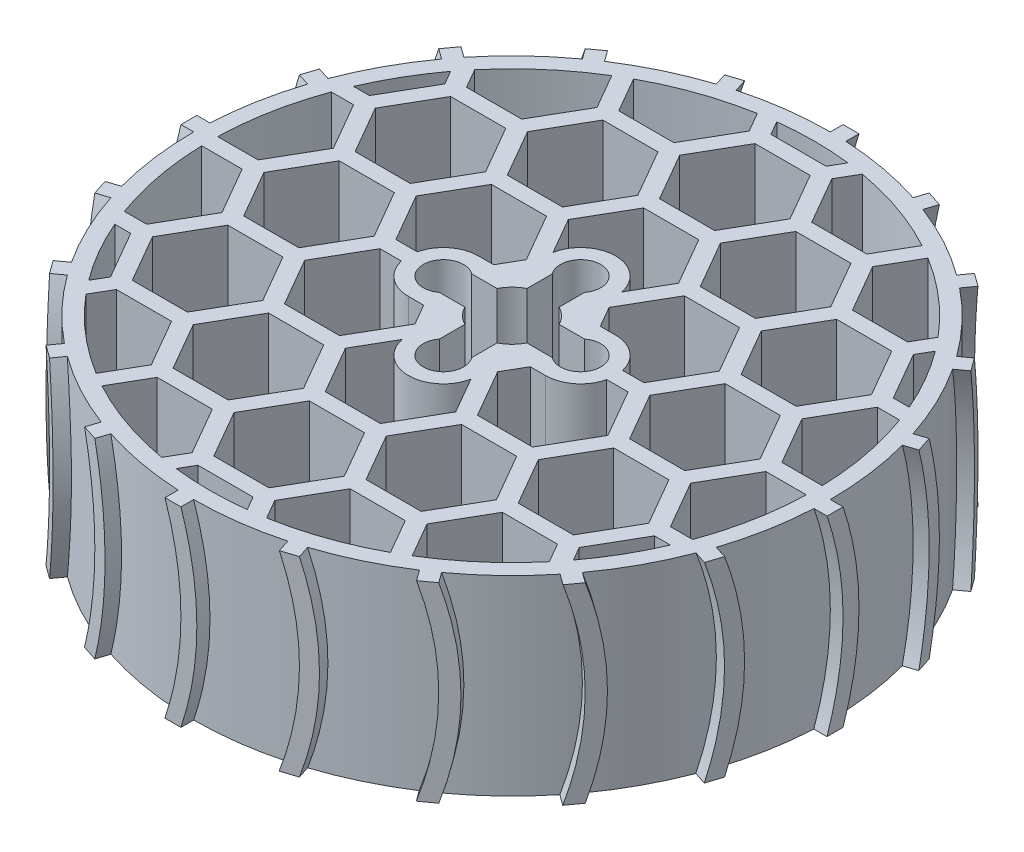
from build123d import *

# Parameters (mm, degrees)
SKETCH3_R             = 6.338999989
SKETCH3_R_2           = 3.302
BOSS_EXTRUDE1_DEPTH   = 30
BOSS_EXTRUDE1_2_DEPTH = 30
BOSS_EXTRUDE1_3_DEPTH = 30
BOSS_EXTRUDE1_4_DEPTH = 30
BOSS_EXTRUDE2_DEPTH   = 60
BOSS_EXTRUDE3_START   = -3
BOSS_EXTRUDE3_DEPTH   = 7
CIRPATTERN1_COUNT     = 20


with BuildPart() as part:
    # Sketch3 → Boss-Extrude1 (new body)
    with BuildSketch(Plane(origin=(0, 0, 0), x_dir=(1, 0, 0), z_dir=(0, 1, 0))):
        with Locations((-21.547999952, -4.4e-08)):
            Circle(SKETCH3_R)
        with Locations((-21.547999942, 4.4e-08)):
            Circle(SKETCH3_R_2, mode=Mode.SUBTRACT)
    extrude(amount=BOSS_EXTRUDE1_DEPTH)



with BuildPart() as body_2:
    # Sketch3 → Boss-Extrude1 2 (new body)
    with BuildSketch(Plane(origin=(0, 0, 0), x_dir=(1, 0, 0), z_dir=(0, 1, 0))):
        with Locations((4.4e-08, -21.547999952)):
            Circle(SKETCH3_R)
        with Locations((-4.4e-08, -21.547999942)):
            Circle(SKETCH3_R_2, mode=Mode.SUBTRACT)
    extrude(amount=BOSS_EXTRUDE1_2_DEPTH)


with BuildPart() as body_3:
    # Sketch3 → Boss-Extrude1 3 (new body)
    with BuildSketch(Plane(origin=(0, 0, 0), x_dir=(1, 0, 0), z_dir=(0, 1, 0))):
        with Locations((-4.4e-08, 21.547999952)):
            Circle(SKETCH3_R)
        with Locations((4.4e-08, 21.547999942)):
            Circle(SKETCH3_R_2, mode=Mode.SUBTRACT)
    extrude(amount=BOSS_EXTRUDE1_3_DEPTH)


with BuildPart() as body_4:
    # Sketch3 → Boss-Extrude1 4 (new body)
    with BuildSketch(Plane(origin=(0, 0, 0), x_dir=(1, 0, 0), z_dir=(0, 1, 0))):
        with Locations((21.547999952, 4.4e-08)):
            Circle(SKETCH3_R)
        with Locations((21.547999942, -4.4e-08)):
            Circle(SKETCH3_R_2, mode=Mode.SUBTRACT)
    extrude(amount=BOSS_EXTRUDE1_4_DEPTH)


with BuildPart() as part_1:
    add(part.part)

    add(body_2.part)  # Boss-Extrude2 merges body 2

    add(body_3.part)  # Boss-Extrude2 merges body 3

    add(body_4.part)  # Boss-Extrude2 merges body 4
    # Sketch3<3> → Boss-Extrude2 (add)
    with BuildSketch(Plane(origin=(0, 0, 0), x_dir=(1, 0, 0), z_dir=(0, 1, 0))):
        with BuildLine():
            ThreePointArc((99.951293704, -3.120718977), (86.602540378, 50), (47.27302494, 88.120718977))
            ThreePointArc((47.27302494, 88.120718977), (0, 100), (-47.27302494, 88.120718977))
            ThreePointArc((-47.27302494, 88.120718977), (-85, 52.678268764), (-99.951293704, 3.120718977))
            ThreePointArc((-99.951293704, 3.120718977), (-100, 0), (-99.951293704, -3.120718977))
            ThreePointArc((-99.951293704, -3.120718977), (-86.602540378, -50), (-52.678268764, -85))
            ThreePointArc((-52.678268764, -85), (-3.120718977, -99.951293704), (47.27302494, -88.120718977))
            ThreePointArc((47.27302494, -88.120718977), (85, -52.678268764), (99.951293704, -3.120718977))
        make_face()
        with BuildLine():
            Line((21.547999916, 10.999999956), (16.743157832, 10.999999956))
            Line((16.743157832, 10.999999956), (12.990381057, 17.5))
            Line((12.990381057, 17.5), (21.650635095, 32.5))
            Line((21.650635095, 32.5), (38.97114317, 32.5))
            Line((38.97114317, 32.5), (47.631397208, 17.5))
            Line((47.631397208, 17.5), (38.97114317, 2.5))
            Line((38.97114317, 2.5), (32.260142549, 2.5))
            ThreePointArc((32.260142549, 2.5), (28.385397064, 8.61684394), (21.547999916, 10.999999956))
        make_face(mode=Mode.SUBTRACT)
        with BuildLine():
            ThreePointArc((21.547999916, -11.000000044), (28.385397099, -8.616844), (32.260142569, -2.5))
            Line((32.260142569, -2.5), (38.97114317, -2.5))
            Line((38.97114317, -2.5), (47.631397208, -17.5))
            Line((47.631397208, -17.5), (38.97114317, -32.5))
            Line((38.97114317, -32.5), (21.650635095, -32.5))
            Line((21.650635095, -32.5), (12.990381057, -17.5))
            Line((12.990381057, -17.5), (16.743157781, -11.000000044))
            Line((16.743157781, -11.000000044), (21.547999916, -11.000000044))
        make_face(mode=Mode.SUBTRACT)
        with BuildLine():
            ThreePointArc((-10.789750135, -23.688395435), (1.4e-08, -32.547999916), (10.789750069, -23.688395321))
            Line((10.789750069, -23.688395321), (17.320508076, -35))
            Line((17.320508076, -35), (8.660254038, -50))
            Line((8.660254038, -50), (-8.660254038, -50))
            Line((-8.660254038, -50), (-17.320508076, -35))
            Line((-17.320508076, -35), (-10.789750135, -23.688395435))
        make_face(mode=Mode.SUBTRACT)
        with BuildLine():
            Line((-21.547999916, -10.999999956), (-16.743157832, -10.999999956))
            Line((-16.743157832, -10.999999956), (-12.990381057, -17.5))
            Line((-12.990381057, -17.5), (-21.650635095, -32.5))
            Line((-21.650635095, -32.5), (-38.97114317, -32.5))
            Line((-38.97114317, -32.5), (-47.631397208, -17.5))
            Line((-47.631397208, -17.5), (-38.97114317, -2.5))
            Line((-38.97114317, -2.5), (-32.260142549, -2.5))
            ThreePointArc((-32.260142549, -2.5), (-28.385397064, -8.61684394), (-21.547999916, -10.999999956))
        make_face(mode=Mode.SUBTRACT)
        with BuildLine():
            ThreePointArc((-21.547999916, 11.000000044), (-28.385397099, 8.616844), (-32.260142569, 2.5))
            Line((-32.260142569, 2.5), (-38.97114317, 2.5))
            Line((-38.97114317, 2.5), (-47.631397208, 17.5))
            Line((-47.631397208, 17.5), (-38.97114317, 32.5))
            Line((-38.97114317, 32.5), (-21.650635095, 32.5))
            Line((-21.650635095, 32.5), (-12.990381057, 17.5))
            Line((-12.990381057, 17.5), (-16.743157781, 11.000000044))
            Line((-16.743157781, 11.000000044), (-21.547999916, 11.000000044))
        make_face(mode=Mode.SUBTRACT)
        with BuildLine():
            ThreePointArc((10.789750135, 23.688395435), (-1.4e-08, 32.547999916), (-10.789750069, 23.688395321))
            Line((-10.789750069, 23.688395321), (-17.320508076, 35))
            Line((-17.320508076, 35), (-8.660254038, 50))
            Line((-8.660254038, 50), (8.660254038, 50))
            Line((8.660254038, 50), (17.320508076, 35))
            Line((17.320508076, 35), (10.789750135, 23.688395435))
        make_face(mode=Mode.SUBTRACT)
        with BuildLine():
            Line((-9.767988863, -5.058299474), (-17.727459802, -5.058299474))
            ThreePointArc((-17.727459768, -5.058299518), (-27.886999941, -8.3e-08), (-17.727459831, 5.058299477))
            Line((-17.727459783, 5.05829954), (-9.767988829, 5.05829954))
            ThreePointArc((-9.767988829, 5.05829954), (-7.778174567, 7.778174619), (-5.058299474, 9.767988863))
            Line((-5.058299474, 9.767988863), (-5.058299474, 17.727459802))
            ThreePointArc((-5.058299518, 17.727459768), (-5.716752026, 18.809082713), (-6.147082036, 20))
            ThreePointArc((-6.147082036, 20), (1.259948972, 27.760523541), (5.058299477, 17.727459831))
            Line((5.05829954, 17.727459783), (5.05829954, 9.767988829))
            ThreePointArc((5.05829954, 9.767988829), (7.778174619, 7.778174567), (9.767988863, 5.058299474))
            Line((9.767988863, 5.058299474), (17.727459802, 5.058299474))
            ThreePointArc((17.727459768, 5.058299518), (27.886999941, 8.3e-08), (17.727459831, -5.058299477))
            Line((17.727459783, -5.05829954), (9.767988829, -5.05829954))
            ThreePointArc((9.767988829, -5.05829954), (7.778174567, -7.778174619), (5.058299474, -9.767988863))
            Line((5.058299474, -9.767988863), (5.058299474, -17.727459802))
            ThreePointArc((5.058299518, -17.727459768), (5.716752026, -18.809082713), (6.147082036, -20))
            ThreePointArc((6.147082036, -20), (-1.259948972, -27.760523541), (-5.058299477, -17.727459831))
            Line((-5.05829954, -17.727459783), (-5.05829954, -9.767988829))
            ThreePointArc((-5.05829954, -9.767988829), (-7.778174619, -7.778174567), (-9.767988863, -5.058299474))
        make_face(mode=Mode.SUBTRACT)
        with BuildLine():
            Line((82.27241336, 37.5), (73.612159322, 52.5))
            Line((73.612159322, 52.5), (76.118678267, 56.841418164))
            ThreePointArc((76.118678267, 56.841418164), (82.27241336, 47.5), (87.28545125, 37.5))
            Line((87.28545125, 37.5), (82.27241336, 37.5))
        make_face(mode=Mode.SUBTRACT)
        with BuildLine():
            Line((82.27241336, 32.5), (89.267855357, 32.5))
            ThreePointArc((89.267855357, 32.5), (93.330754062, 17.730491988), (94.967099566, 2.5))
            Line((94.967099566, 2.5), (82.27241336, 2.5))
            Line((82.27241336, 2.5), (73.612159322, 17.5))
            Line((73.612159322, 17.5), (82.27241336, 32.5))
        make_face(mode=Mode.SUBTRACT)
        with BuildLine():
            Line((82.27241336, -2.5), (94.967099566, -2.5))
            ThreePointArc((94.967099566, -2.5), (93.330754062, -17.730491988), (89.267855357, -32.5))
            Line((89.267855357, -32.5), (82.27241336, -32.5))
            Line((82.27241336, -32.5), (73.612159322, -17.5))
            Line((73.612159322, -17.5), (82.27241336, -2.5))
        make_face(mode=Mode.SUBTRACT)
        with BuildLine():
            Line((82.27241336, -37.5), (87.28545125, -37.5))
            ThreePointArc((87.28545125, -37.5), (82.27241336, -47.5), (76.118678267, -56.841418164))
            Line((76.118678267, -56.841418164), (73.612159322, -52.5))
            Line((73.612159322, -52.5), (82.27241336, -37.5))
        make_face(mode=Mode.SUBTRACT)
        with BuildLine():
            Line((69.282032303, -55), (72.779753301, -61.05823048))
            ThreePointArc((72.779753301, -61.05823048), (62.020433514, -71.961557978), (49.648613293, -80.993920748))
            Line((49.648613293, -80.993920748), (43.301270189, -70))
            Line((43.301270189, -70), (51.961524227, -55))
            Line((51.961524227, -55), (69.282032303, -55))
        make_face(mode=Mode.SUBTRACT)
        with BuildLine():
            Line((38.97114317, -72.5), (45.318486274, -83.493920748))
            ThreePointArc((45.318486274, -83.493920748), (31.310320548, -89.692049966), (16.488102055, -93.55823048))
            Line((16.488102055, -93.55823048), (12.990381057, -87.5))
            Line((12.990381057, -87.5), (21.650635095, -72.5))
            Line((21.650635095, -72.5), (38.97114317, -72.5))
        make_face(mode=Mode.SUBTRACT)
        with BuildLine():
            Line((8.660254038, -90), (11.166772983, -94.341418164))
            ThreePointArc((11.166772983, -94.341418164), (0, -95), (-11.166772983, -94.341418164))
            Line((-11.166772983, -94.341418164), (-8.660254038, -90))
            Line((-8.660254038, -90), (8.660254038, -90))
        make_face(mode=Mode.SUBTRACT)
        with BuildLine():
            Line((-12.990381057, -87.5), (-16.488102055, -93.55823048))
            ThreePointArc((-16.488102055, -93.55823048), (-31.310320548, -89.692049966), (-45.318486274, -83.493920748))
            Line((-45.318486274, -83.493920748), (-38.97114317, -72.5))
            Line((-38.97114317, -72.5), (-21.650635095, -72.5))
            Line((-21.650635095, -72.5), (-12.990381057, -87.5))
        make_face(mode=Mode.SUBTRACT)
        with BuildLine():
            Line((-43.301270189, -70), (-49.648613293, -80.993920748))
            ThreePointArc((-49.648613293, -80.993920748), (-62.020433514, -71.961557978), (-72.779753301, -61.05823048))
            Line((-72.779753301, -61.05823048), (-69.282032303, -55))
            Line((-69.282032303, -55), (-51.961524227, -55))
            Line((-51.961524227, -55), (-43.301270189, -70))
        make_face(mode=Mode.SUBTRACT)
        with BuildLine():
            Line((-73.612159322, -52.5), (-76.118678267, -56.841418164))
            ThreePointArc((-76.118678267, -56.841418164), (-82.27241336, -47.5), (-87.28545125, -37.5))
            Line((-87.28545125, -37.5), (-82.27241336, -37.5))
            Line((-82.27241336, -37.5), (-73.612159322, -52.5))
        make_face(mode=Mode.SUBTRACT)
        with BuildLine():
            Line((-82.27241336, -32.5), (-89.267855357, -32.5))
            ThreePointArc((-89.267855357, -32.5), (-93.330754062, -17.730491988), (-94.967099566, -2.5))
            Line((-94.967099566, -2.5), (-82.27241336, -2.5))
            Line((-82.27241336, -2.5), (-73.612159322, -17.5))
            Line((-73.612159322, -17.5), (-82.27241336, -32.5))
        make_face(mode=Mode.SUBTRACT)
        with BuildLine():
            Line((-82.272413359, 2.5), (-94.967099566, 2.5))
            ThreePointArc((-94.967099566, 2.5), (-93.330754062, 17.730491988), (-89.267855357, 32.5))
            Line((-89.267855357, 32.5), (-82.272413359, 32.5))
            Line((-82.272413359, 32.5), (-73.612159322, 17.5))
            Line((-73.612159322, 17.5), (-82.272413359, 2.5))
        make_face(mode=Mode.SUBTRACT)
        with BuildLine():
            Line((-82.27241336, 37.5), (-87.28545125, 37.5))
            ThreePointArc((-87.28545125, 37.5), (-82.27241336, 47.5), (-76.118678267, 56.841418164))
            Line((-76.118678267, 56.841418164), (-73.612159322, 52.5))
            Line((-73.612159322, 52.5), (-82.27241336, 37.5))
        make_face(mode=Mode.SUBTRACT)
        with BuildLine():
            Line((-69.282032303, 55), (-72.779753301, 61.05823048))
            ThreePointArc((-72.779753301, 61.05823048), (-62.020433514, 71.961557978), (-49.648613293, 80.993920748))
            Line((-49.648613293, 80.993920748), (-43.301270189, 70))
            Line((-43.301270189, 70), (-51.961524227, 55))
            Line((-51.961524227, 55), (-69.282032303, 55))
        make_face(mode=Mode.SUBTRACT)
        with BuildLine():
            Line((-38.97114317, 72.5), (-45.318486274, 83.493920748))
            ThreePointArc((-45.318486274, 83.493920748), (-31.310320548, 89.692049966), (-16.488102055, 93.55823048))
            Line((-16.488102055, 93.55823048), (-12.990381057, 87.5))
            Line((-12.990381057, 87.5), (-21.650635095, 72.5))
            Line((-21.650635095, 72.5), (-38.97114317, 72.5))
        make_face(mode=Mode.SUBTRACT)
        with BuildLine():
            Line((-8.660254038, 90), (-11.166772983, 94.341418164))
            ThreePointArc((-11.166772983, 94.341418164), (0, 95), (11.166772983, 94.341418164))
            Line((11.166772983, 94.341418164), (8.660254038, 90))
            Line((8.660254038, 90), (-8.660254038, 90))
        make_face(mode=Mode.SUBTRACT)
        with BuildLine():
            Line((12.990381057, 87.5), (16.488102055, 93.55823048))
            ThreePointArc((16.488102055, 93.55823048), (31.310320548, 89.692049966), (45.318486274, 83.493920748))
            Line((45.318486274, 83.493920748), (38.97114317, 72.5))
            Line((38.97114317, 72.5), (21.650635095, 72.5))
            Line((21.650635095, 72.5), (12.990381057, 87.5))
        make_face(mode=Mode.SUBTRACT)
        with BuildLine():
            Line((43.301270189, 70), (49.648613293, 80.993920748))
            ThreePointArc((49.648613293, 80.993920748), (62.020433514, 71.961557978), (72.779753301, 61.05823048))
            Line((72.779753301, 61.05823048), (69.282032303, 55))
            Line((69.282032303, 55), (51.961524227, 55))
            Line((51.961524227, 55), (43.301270189, 70))
        make_face(mode=Mode.SUBTRACT)
        Polygon((-69.282032303, -20), (-51.961524227, -20), (-43.301270189, -35), (-51.961524227, -50), (-69.282032303, -50), (-77.942286341, -35), align=None, mode=Mode.SUBTRACT)
        Polygon((-38.97114317, -37.5), (-21.650635095, -37.5), (-12.990381057, -52.5), (-21.650635095, -67.5), (-38.97114317, -67.5), (-47.631397208, -52.5), align=None, mode=Mode.SUBTRACT)
        Polygon((-69.282032303, 15), (-51.961524227, 15), (-43.301270189, 0), (-51.961524227, -15), (-69.282032303, -15), (-77.942286341, 0), align=None, mode=Mode.SUBTRACT)
        Polygon((-69.282032303, 50), (-51.961524227, 50), (-43.301270189, 35), (-51.961524227, 20), (-69.282032303, 20), (-77.942286341, 35), align=None, mode=Mode.SUBTRACT)
        Polygon((-8.660254038, -55), (8.660254038, -55), (17.320508076, -70), (8.660254038, -85), (-8.660254038, -85), (-17.320508076, -70), align=None, mode=Mode.SUBTRACT)
        Polygon((21.650635095, -37.5), (38.97114317, -37.5), (47.631397208, -52.5), (38.97114317, -67.5), (21.650635095, -67.5), (12.990381057, -52.5), align=None, mode=Mode.SUBTRACT)
        Polygon((51.961524227, -20), (69.282032303, -20), (77.942286341, -35), (69.282032303, -50), (51.961524227, -50), (43.301270189, -35), align=None, mode=Mode.SUBTRACT)
        Polygon((-12.990381057, 52.5), (-21.650635095, 37.5), (-38.97114317, 37.5), (-47.631397208, 52.5), (-38.97114317, 67.5), (-21.650635095, 67.5), align=None, mode=Mode.SUBTRACT)
        Polygon((-8.660254038, 85), (8.660254038, 85), (17.320508076, 70), (8.660254038, 55), (-8.660254038, 55), (-17.320508076, 70), align=None, mode=Mode.SUBTRACT)
        Polygon((38.97114317, 37.5), (21.650635095, 37.5), (12.990381057, 52.5), (21.650635095, 67.5), (38.97114317, 67.5), (47.631397208, 52.5), align=None, mode=Mode.SUBTRACT)
        Polygon((51.961524227, 15), (69.282032303, 15), (77.942286341, 0), (69.282032303, -15), (51.961524227, -15), (43.301270189, 0), align=None, mode=Mode.SUBTRACT)
        Polygon((51.961524227, 50), (69.282032303, 50), (77.942286341, 35), (69.282032303, 20), (51.961524227, 20), (43.301270189, 35), align=None, mode=Mode.SUBTRACT)
    extrude(amount=BOSS_EXTRUDE2_DEPTH)

    # Sketch4 → Boss-Extrude3 (add)
    with BuildSketch(Plane.ZY.offset(100).offset(BOSS_EXTRUDE3_START)):
        with BuildLine():
            Line((-5, 60), (0, 60))
            add(Edge.make_bspline(
                [(0, 60), (10, 30), (0, 0)],
                knots=[0, 0, 0, 1, 1, 1], degree=2))
            Line((0, 0), (-5.05829954, 0))
            add(Edge.make_bspline(
                [(-5.05829954, 0), (5.029140786, 29.990493917), (-5, 60)],
                knots=[0, 0, 0, 1, 1, 1], degree=2))
        make_face()
    boss_extrude3 = extrude(amount=BOSS_EXTRUDE3_DEPTH)

    # CirPattern1: Boss-Extrude3 ×20 about axis
    cirpattern1_axis = Axis((0, 60, 0), (0, -1, 0))
    for i in range(1, CIRPATTERN1_COUNT):
        add(boss_extrude3.rotate(cirpattern1_axis, i * 360 / CIRPATTERN1_COUNT))


solid = part_1.part
